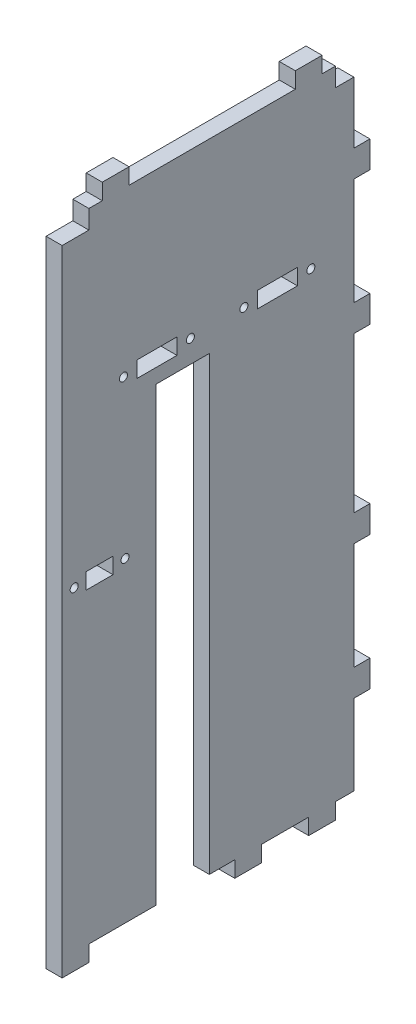
from build123d import *

# Parameters (mm, degrees)
ESQUISSE1_W             = 109
ESQUISSE1_H             = 238
ESQUISSE1_W_2           = 10
ESQUISSE1_H_2           = 6
ESQUISSE1_W_3           = 15
BOSS_EXTRU_1_DEPTH      = 6
ESQUISSE3_W             = 10
ESQUISSE3_H             = 6
ESQUISSE3_W_2           = 6
ESQUISSE3_H_2           = 10
BOSS_EXTRU_5_DEPTH      = 6
ESQUISSE6_W             = 20
ESQUISSE6_H             = 168.59
ENL_V_MAT_EXTRU_2_DEPTH = 6
ESQUISSE7_W             = 6.88
ESQUISSE7_H             = 7
ENL_V_MAT_EXTRU_3_DEPTH = 6
ESQUISSE8_R             = 1.5
ENL_V_MAT_EXTRU_4_DEPTH = 6
ESQUISSE9_W             = 10
ESQUISSE9_H             = 7
ENL_V_MAT_EXTRU_5_DEPTH = 6


with BuildPart() as part:
    # Esquisse1 → Boss.-Extru.1 (new body)
    with BuildSketch(Plane(origin=(0, 0, 0), x_dir=(0, 0, -1), z_dir=(1, 0, 0))):
        Rectangle(ESQUISSE1_W, ESQUISSE1_H)
        with Locations((-40.5, -1)):
            Rectangle(ESQUISSE1_W_2, ESQUISSE1_H_2, mode=Mode.SUBTRACT)
        with Locations((-19.085, 58)):
            Rectangle(ESQUISSE1_W_3, ESQUISSE1_H_2, mode=Mode.SUBTRACT)
        with Locations((25.915, 58)):
            Rectangle(ESQUISSE1_W_3, ESQUISSE1_H_2, mode=Mode.SUBTRACT)
    extrude(amount=BOSS_EXTRU_1_DEPTH)

    # Esquisse3 → Boss.-Extru.5 (add)
    with BuildSketch(Plane(origin=(6, 0, 0), x_dir=(0, 0, -1), z_dir=(1, 0, 0))):
        with Locations((-49.5, -122)):
            Rectangle(ESQUISSE3_W, ESQUISSE3_H)
        with Locations((42.62, -122)):
            Rectangle(ESQUISSE3_W, ESQUISSE3_H)
        with Locations((57.5, 34)):
            Rectangle(ESQUISSE3_W_2, ESQUISSE3_H_2)
        with Locations((57.5, 84)):
            Rectangle(ESQUISSE3_W_2, ESQUISSE3_H_2)
        with Locations((57.5, -84)):
            Rectangle(ESQUISSE3_W_2, ESQUISSE3_H_2)
        with Locations((57.5, -34)):
            Rectangle(ESQUISSE3_W_2, ESQUISSE3_H_2)
        with Locations((15, -122)):
            Rectangle(ESQUISSE3_W, ESQUISSE3_H)
        with Locations((37.62, 122)):
            Rectangle(ESQUISSE3_W, ESQUISSE3_H)
        with Locations((-34.5, 122)):
            Rectangle(ESQUISSE3_W, ESQUISSE3_H)
    extrude(amount=-BOSS_EXTRU_5_DEPTH)

    # Esquisse6 → Enlèv. mat.-Extru.2 (cut)
    with BuildSketch(Plane(origin=(6, 0, 0), x_dir=(0, 0, -1), z_dir=(1, 0, 0))):
        with Locations((-9.5, -34.705)):
            Rectangle(ESQUISSE6_W, ESQUISSE6_H)
    extrude(amount=-ENL_V_MAT_EXTRU_2_DEPTH, mode=Mode.SUBTRACT)

    # Esquisse7 → Enlèv. mat.-Extru.3 (cut)
    with BuildSketch(Plane.ZY):
        with Locations((-51.06, 115.5)):
            Rectangle(ESQUISSE7_W, ESQUISSE7_H)
    extrude(amount=-ENL_V_MAT_EXTRU_3_DEPTH, mode=Mode.SUBTRACT)

    # Esquisse8 → Enlèv. mat.-Extru.4 (cut)
    with BuildSketch(Plane.ZY):
        with Locations((-38.415, 58)):
            Circle(ESQUISSE8_R)
        with Locations((-13.415, 58)):
            Circle(ESQUISSE8_R)
        with Locations((6.585, 58)):
            Circle(ESQUISSE8_R)
        with Locations((31.585, 58)):
            Circle(ESQUISSE8_R)
        with Locations((31, -1)):
            Circle(ESQUISSE8_R)
        with Locations((50, -1)):
            Circle(ESQUISSE8_R)
    extrude(amount=-ENL_V_MAT_EXTRU_4_DEPTH, mode=Mode.SUBTRACT)

    # Esquisse9 → Enlèv. mat.-Extru.5 (cut)
    with BuildSketch(Plane.ZY):
        with Locations((49.5, 115.5)):
            Rectangle(ESQUISSE9_W, ESQUISSE9_H)
    extrude(amount=-ENL_V_MAT_EXTRU_5_DEPTH, mode=Mode.SUBTRACT)


solid = part.part
